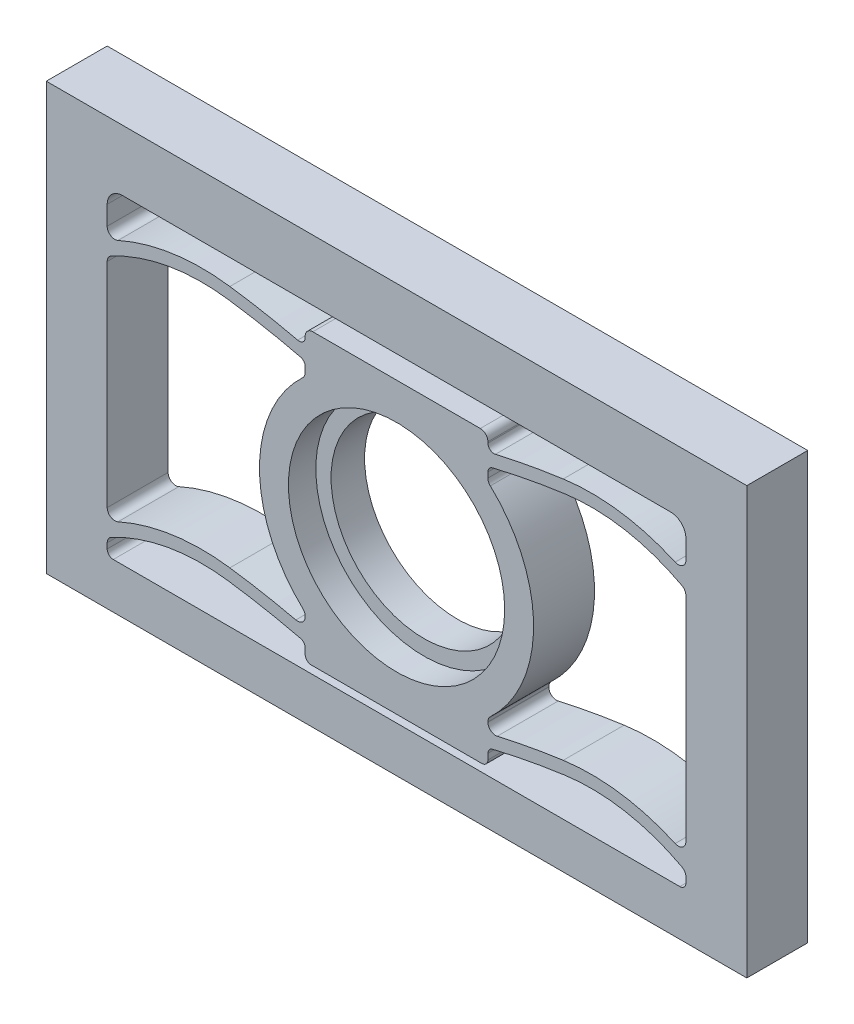
from build123d import *

# Parameters (mm, degrees)
SKETCH_2_R          = 7.1
SKETCH_2_R_2        = 6.1
EXTRUDE_1_DEPTH     = 2.2
SKETCH_2_3_R        = 9
SKETCH_2_3_R_2      = 7.1
EXTRUDE_2_DEPTH     = 4
EXTRUDE_3_DEPTH     = 4
SKETCH_4_W          = 46
SKETCH_4_H          = 28
SKETCH_4_W_2        = 38
SKETCH_4_H_2        = 21
EXTRUDE_4_DEPTH     = 4
EXTRUDE_1_2_DEPTH   = 4
DELETE_FACE_1_DEPTH = 4
FILLET_4_R          = 0.5
FILLET_5_R          = 0.4
FILLET_6_R          = 1


# Read off the part's stored shape, not the designer's step: 删除面1
with BuildPart() as part:
    # 草图2 → Extrude 1 (new body)
    with BuildSketch(Plane.XY):
        Circle(SKETCH_2_R)
        Circle(SKETCH_2_R_2, mode=Mode.SUBTRACT)
    extrude(amount=EXTRUDE_1_DEPTH)

    # 草图2<3> → 凸台-拉伸2 (add)
    with BuildSketch(Plane.XY):
        Circle(SKETCH_2_3_R)
        Circle(SKETCH_2_3_R_2, mode=Mode.SUBTRACT)
    extrude(amount=EXTRUDE_2_DEPTH)

    # 草图3 → 凸台-拉伸3 (add)
    with BuildSketch(Plane.XY):
        with BuildLine():
            Line((6, 6.708203932), (6, 9.5))
            Line((6, 9.5), (-6, 9.5))
            Line((-6, 9.5), (-6, 6.708203932))
            ThreePointArc((-6, 6.708203932), (0, 9), (6, 6.708203932))
        make_face()
        with BuildLine():
            Line((-6, -9.5), (6, -9.5))
            Line((6, -9.5), (6, -6.708203932))
            ThreePointArc((6, -6.708203932), (0, -9), (-6, -6.708203932))
            Line((-6, -6.708203932), (-6, -9.5))
        make_face()
    extrude(amount=EXTRUDE_3_DEPTH)



with BuildPart() as body_2:
    # 草图4 → 凸台-拉伸4 (new body)
    with BuildSketch(Plane.XY):
        with Locations((0, 1)):
            Rectangle(SKETCH_4_W, SKETCH_4_H)
        with Locations((0, 0.5)):
            Rectangle(SKETCH_4_W_2, SKETCH_4_H_2, mode=Mode.SUBTRACT)
    extrude(amount=EXTRUDE_4_DEPTH)


with BuildPart() as part_1:
    add(part.part)

    add(body_2.part)  # Extrude 1 2 merges body 2
    # 草图7 → Extrude 1 2 (add)
    with BuildSketch(Plane.XY):
        with BuildLine():
            ThreePointArc((19.19111663, -8.148610709), (15.188418529, -6.736776188), (10.944962783, -6.647601418))
            ThreePointArc((10.944962783, -6.647601418), (8.412688328, -7.06534444), (5.904962783, -7.611454086))
            Line((5.904962783, -7.611454086), (6.095037217, -8.388545914))
            ThreePointArc((6.095037217, -8.388545914), (8.562957594, -7.851104675), (11.055037217, -7.439992495))
            ThreePointArc((11.055037217, -7.439992495), (15.04515232, -7.523843398), (18.80888337, -8.851389291))
            Line((18.80888337, -8.851389291), (19.19111663, -8.148610709))
        make_face()
        with BuildLine():
            ThreePointArc((-18.80888337, -8.851389291), (-15.04515232, -7.523843398), (-11.055037217, -7.439992495))
            ThreePointArc((-11.055037217, -7.439992495), (-8.562957594, -7.851104675), (-6.095037217, -8.388545914))
            Line((-6.095037217, -8.388545914), (-5.904962783, -7.611454086))
            ThreePointArc((-5.904962783, -7.611454086), (-8.412688328, -7.06534444), (-10.944962783, -6.647601418))
            ThreePointArc((-10.944962783, -6.647601418), (-15.188418529, -6.736776188), (-19.19111663, -8.148610709))
            Line((-19.19111663, -8.148610709), (-18.80888337, -8.851389291))
        make_face()
        with BuildLine():
            ThreePointArc((-18.80888337, 7.148610709), (-15.04515232, 8.476156602), (-11.055037217, 8.560007505))
            ThreePointArc((-11.055037217, 8.560007505), (-8.562957594, 8.148895325), (-6.095037217, 7.611454086))
            Line((-6.095037217, 7.611454086), (-5.904962783, 8.388545914))
            ThreePointArc((-5.904962783, 8.388545914), (-8.412688328, 8.93465556), (-10.944962783, 9.352398582))
            ThreePointArc((-10.944962783, 9.352398582), (-15.188418529, 9.263223812), (-19.19111663, 7.851389291))
            Line((-19.19111663, 7.851389291), (-18.80888337, 7.148610709))
        make_face()
        with BuildLine():
            ThreePointArc((19.19111663, 7.851389291), (15.188418529, 9.263223812), (10.944962783, 9.352398582))
            ThreePointArc((10.944962783, 9.352398582), (8.412688328, 8.93465556), (5.904962783, 8.388545914))
            Line((5.904962783, 8.388545914), (6.095037217, 7.611454086))
            ThreePointArc((6.095037217, 7.611454086), (8.562957594, 8.148895325), (11.055037217, 8.560007505))
            ThreePointArc((11.055037217, 8.560007505), (15.04515232, 8.476156602), (18.80888337, 7.148610709))
            Line((18.80888337, 7.148610709), (19.19111663, 7.851389291))
        make_face()
    extrude(amount=EXTRUDE_1_2_DEPTH)

    # Delete Face 1 outline → Delete Face 1 (add)
    with BuildSketch(Plane.XY):
        with BuildLine():
            ThreePointArc((-19, 7.042506057), (-18.904671788, 7.095972847), (-18.80888337, 7.148610709))
            Line((-18.80888337, 7.148610709), (-19, 7.5))
            Line((-19, 7.5), (-19, 7.042506057))
        make_face()
        with BuildLine():
            Line((-6, 7.588108866), (-6, 8))
            Line((-6, 8), (-6.095037217, 7.611454086))
            ThreePointArc((-6.095037217, 7.611454086), (-6.047512851, 7.599804915), (-6, 7.588108866))
        make_face()
        with BuildLine():
            ThreePointArc((-19, -8.957493943), (-18.904671788, -8.904027153), (-18.80888337, -8.851389291))
            Line((-18.80888337, -8.851389291), (-19, -8.5))
            Line((-19, -8.5), (-19, -8.957493943))
        make_face()
        with BuildLine():
            Line((-6, -8.411891134), (-6, -8))
            Line((-6, -8), (-6.095037217, -8.388545914))
            ThreePointArc((-6.095037217, -8.388545914), (-6.047512851, -8.400195085), (-6, -8.411891134))
        make_face()
        with BuildLine():
            Line((6.095037217, 7.611454086), (6, 8))
            Line((6, 8), (6, 7.588108866))
            ThreePointArc((6, 7.588108866), (6.047512851, 7.599804915), (6.095037217, 7.611454086))
        make_face()
        with BuildLine():
            Line((19, 7.5), (18.80888337, 7.148610709))
            ThreePointArc((18.80888337, 7.148610709), (18.904671788, 7.095972847), (19, 7.042506057))
            Line((19, 7.042506057), (19, 7.5))
        make_face()
        with BuildLine():
            Line((6.095037217, -8.388545914), (6, -8))
            Line((6, -8), (6, -8.411891134))
            ThreePointArc((6, -8.411891134), (6.047512851, -8.400195085), (6.095037217, -8.388545914))
        make_face()
        with BuildLine():
            Line((19, -8.5), (18.80888337, -8.851389291))
            ThreePointArc((18.80888337, -8.851389291), (18.904671788, -8.904027153), (19, -8.957493943))
            Line((19, -8.957493943), (19, -8.5))
        make_face()
    extrude(amount=DELETE_FACE_1_DEPTH)

    # 圆角4
    fillet_4_edges = [part_1.edges().sort_by_distance(p)[0] for p in [
        (19, -8.046657496, 2),
        (6, -7.588305973, 2),
        (-19, -8.046657496, 2),
        (-6, -7.588305973, 2),
        (-6, 9.5, 2),
        (6, 9.5, 2),
        (6, 6.708203932, 2),
        (-6, 6.708203932, 2),
        (19, -8.957493943, 2),
        (-19, -8.957493943, 2),
        (-19, 7.042506057, 2),
        (19, 7.042506057, 2),
        (6, -6.708203932, 2),
        (-6, -6.708203932, 2),
        (-19, 7.953342504, 2),
        (19, 7.953342504, 2),
    ]]
    fillet(fillet_4_edges, radius=FILLET_4_R)

    # 圆角5
    fillet_5_edges = [part_1.edges().sort_by_distance(p)[0] for p in [
        (6, -8.411891134, 2),
        (-6, -8.411891134, 2),
        (-6, 7.588108866, 2),
        (6, 7.588108866, 2),
        (-6, -9.5, 2),
        (6, -9.5, 2),
        (-6, 8.411694027, 2),
        (-19, -10, 2),
        (19, -10, 2),
        (6, 8.411694027, 2),
    ]]
    fillet(fillet_5_edges, radius=FILLET_5_R)

    # 圆角6
    fillet_6_edges = [part_1.edges().sort_by_distance(p)[0] for p in [
        (19, 11, 2),
        (-19, 11, 2),
    ]]
    fillet(fillet_6_edges, radius=FILLET_6_R)


solid = part_1.part
